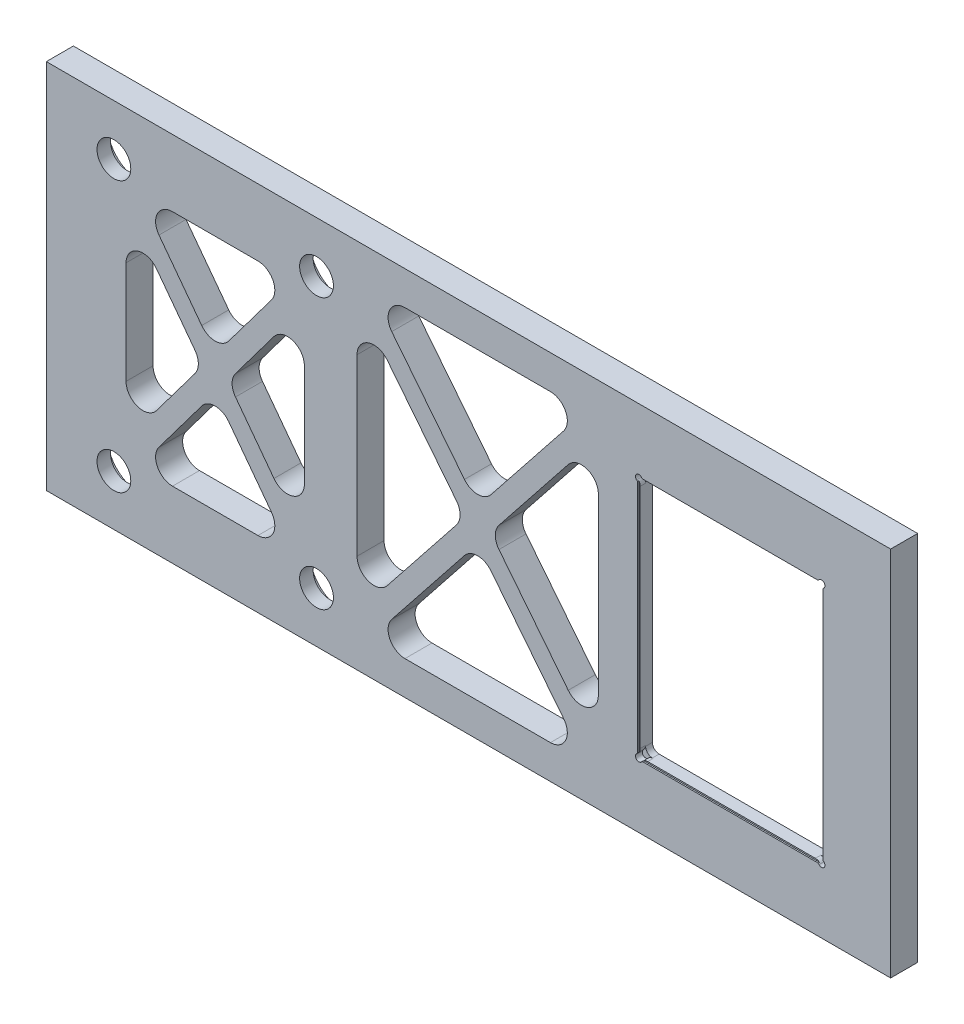
from build123d import *

# Parameters (mm, degrees)
SKETCH1_W           = 125
SKETCH1_H           = 55
SKETCH1_R           = 2.5
SKETCH1_W_2         = 27.05
SKETCH1_H_2         = 35.85
BOSS_EXTRUDE1_DEPTH = 4
SKETCH2_R           = 0.5
CUT_EXTRUDE1_DEPTH  = 1
FILLET1_R           = 1
FILLET2_R           = 1
SKETCH7_W           = 27.45
SKETCH7_H           = 36.25
CUT_EXTRUDE2_DEPTH  = 0.2
CUT_EXTRUDE3_DEPTH  = 2
CUT_EXTRUDE4_DEPTH  = 1
CUT_EXTRUDE5_DEPTH  = 137.623570441
CUT_EXTRUDE6_DEPTH  = 137.623570441
FILLET3_R           = 2.5
SKETCH12_R          = 5
CUT_EXTRUDE7_DEPTH  = 2


with BuildPart() as part:
    # Sketch1 → Boss-Extrude1 (new body)
    with BuildSketch(Plane.XY):
        with Locations((62.5, 27.5)):
            Rectangle(SKETCH1_W, SKETCH1_H)
        with Locations((10, 47.5)):
            Circle(SKETCH1_R, mode=Mode.SUBTRACT)
        with Locations((40, 47.5)):
            Circle(SKETCH1_R, mode=Mode.SUBTRACT)
        with Locations((10, 7.5)):
            Circle(SKETCH1_R, mode=Mode.SUBTRACT)
        with Locations((40, 7.5)):
            Circle(SKETCH1_R, mode=Mode.SUBTRACT)
        with Locations((101.25, 27.5)):
            Rectangle(SKETCH1_W_2, SKETCH1_H_2, mode=Mode.SUBTRACT)
    extrude(amount=BOSS_EXTRUDE1_DEPTH)

    # Sketch2 → Cut-Extrude1 (cut)
    with BuildSketch(Plane.XY.offset(4)):
        with Locations((87.725, 45.425)):
            Circle(SKETCH2_R)
        with Locations((114.775, 45.425)):
            Circle(SKETCH2_R)
        with Locations((87.725, 9.575)):
            Circle(SKETCH2_R)
        with Locations((114.775, 9.575)):
            Circle(SKETCH2_R)
    extrude(amount=-CUT_EXTRUDE1_DEPTH, mode=Mode.SUBTRACT)

    # Fillet1
    # the kernel refuses this fillet: 1 mm, written as the material it adds along each edge
    with BuildSketch(Plane(origin=(114.775, 9.575, 0), x_dir=(-1, 0, 0), z_dir=(0, 0, 1))) as fillet1_piece_1_section:
        with BuildLine():
            CenterArc((FILLET1_R, -FILLET1_R), FILLET1_R, 90, 90)
            Line((0, -FILLET1_R), (0, 0))
            Line((0, 0), (FILLET1_R, 0))
        make_face()
    fillet1_piece_1 = extrude(amount=5.5, mode=Mode.PRIVATE)
    fillet1_piece_1 = split(fillet1_piece_1, bisect_by=Plane(origin=(114.157064257, 9.617383677, 4), z_dir=(0, 0, -1)), keep=Keep.TOP, mode=Mode.PRIVATE)
    fillet1_piece_1 = fillet1_piece_1 - Plane(origin=(114.775, 9.575, 1.5), x_dir=(1, 0, 0), z_dir=(0, 0, 1)) * Cylinder(0.5, 16, mode=Mode.PRIVATE)
    add(fillet1_piece_1)
    with BuildSketch(Plane(origin=(114.775, 9.575, 0), x_dir=(-1, 0, 0), z_dir=(0, 0, 1)), Plane(origin=(87.725, 9.575, 0), x_dir=(0, 1, 0), z_dir=(0, 0, 1)), Plane(origin=(114.775, 45.425, 0), x_dir=(0, -1, 0), z_dir=(0, 0, 1))) as fillet1_piece_2:
        with BuildLine():
            CenterArc((FILLET1_R, -FILLET1_R), FILLET1_R, 90, 90)
            Line((0, -FILLET1_R), (0, 0))
            Line((0, 0), (FILLET1_R, 0))
        make_face()
    extrude(amount=3)
    with BuildSketch(Plane(origin=(87.725, 9.575, 0), x_dir=(0, 1, 0), z_dir=(0, 0, 1))) as fillet1_piece_3_section:
        with BuildLine():
            CenterArc((FILLET1_R, -FILLET1_R), FILLET1_R, 90, 90)
            Line((0, -FILLET1_R), (0, 0))
            Line((0, 0), (FILLET1_R, 0))
        make_face()
    fillet1_piece_3 = extrude(amount=5.5, mode=Mode.PRIVATE)
    fillet1_piece_3 = split(fillet1_piece_3, bisect_by=Plane(origin=(87.767383677, 10.192935743, 4), z_dir=(0, 0, -1)), keep=Keep.TOP, mode=Mode.PRIVATE)
    fillet1_piece_3 = fillet1_piece_3 - Plane(origin=(87.725, 9.575, 1.5), x_dir=(1, 0, 0), z_dir=(0, 0, 1)) * Cylinder(0.5, 15, mode=Mode.PRIVATE)
    add(fillet1_piece_3)
    with BuildSketch(Plane(origin=(114.775, 45.425, 0), x_dir=(0, -1, 0), z_dir=(0, 0, 1))) as fillet1_piece_4_section:
        with BuildLine():
            CenterArc((FILLET1_R, -FILLET1_R), FILLET1_R, 90, 90)
            Line((0, -FILLET1_R), (0, 0))
            Line((0, 0), (FILLET1_R, 0))
        make_face()
    fillet1_piece_4 = extrude(amount=5.5, mode=Mode.PRIVATE)
    fillet1_piece_4 = split(fillet1_piece_4, bisect_by=Plane(origin=(114.732616323, 44.807064257, 4), z_dir=(0, 0, -1)), keep=Keep.TOP, mode=Mode.PRIVATE)
    fillet1_piece_4 = fillet1_piece_4 - Plane(origin=(114.775, 45.425, 1.5), x_dir=(1, 0, 0), z_dir=(0, 0, 1)) * Cylinder(0.5, 15, mode=Mode.PRIVATE)
    add(fillet1_piece_4)
    with BuildSketch(Plane(origin=(87.725, 45.425, 0), x_dir=(0, -1, 0), z_dir=(0, 0, 1))) as fillet1_piece_5_section:
        with BuildLine():
            CenterArc((FILLET1_R, FILLET1_R), FILLET1_R, 180, 90)
            Line((0, FILLET1_R), (0, 0))
            Line((0, 0), (FILLET1_R, 0))
        make_face()
    fillet1_piece_5 = extrude(amount=5.5, mode=Mode.PRIVATE)
    fillet1_piece_5 = split(fillet1_piece_5, bisect_by=Plane(origin=(87.767383677, 44.807064257, 4), z_dir=(0, 0, -1)), keep=Keep.TOP, mode=Mode.PRIVATE)
    fillet1_piece_5 = fillet1_piece_5 - Plane(origin=(87.725, 45.425, 1.5), x_dir=(1, 0, 0), z_dir=(0, 0, 1)) * Cylinder(0.5, 16, mode=Mode.PRIVATE)
    add(fillet1_piece_5)
    with BuildSketch(Plane(origin=(87.725, 45.425, 0), x_dir=(0, -1, 0), z_dir=(0, 0, 1))) as fillet1_piece_6:
        with BuildLine():
            CenterArc((FILLET1_R, FILLET1_R), FILLET1_R, 180, 90)
            Line((0, FILLET1_R), (0, 0))
            Line((0, 0), (FILLET1_R, 0))
        make_face()
    extrude(amount=3)

    # Fillet2
    # the kernel refuses this fillet: 1 mm, written as the material it takes off along each edge
    with BuildSketch(Plane(origin=(114.297140543, 9.722140543, 5.642166577), x_dir=(-0.9745882982080014, -0.22400368076447263, 0), z_dir=(0, 0, -1)), Plane(origin=(87.872140543, 10.052859457, 5.642166577), x_dir=(-0.22400368076451274, 0.9745882982079922, 0), z_dir=(0, 0, -1)), Plane(origin=(114.627859457, 44.947140543, 5.642166577), x_dir=(0.22400368076446278, -0.9745882982080036, 0), z_dir=(0, 0, -1)), Plane(origin=(88.202859457, 45.277859457, 5.642166577), x_dir=(0.974588298207998, 0.22400368076448807, 0), z_dir=(0, 0, -1))) as fillet2_piece_1:
        with BuildLine():
            CenterArc((0.880870312, -0.974588298), FILLET2_R, 102.944297934, 48.189685104)
            Line((0.005119296, -0.491825252), (-0.082455806, -0.443548947))
            ThreePointArc((-0.082455806, -0.443548947), (-0.032777878, -0.246280446), (-0.086551242, -0.050088746))
            Line((-0.086551242, -0.050088746), (0.031782841, 0.094814825))
            ThreePointArc((0.031782841, 0.094814825), (0.519431718, 0.071018782), (0.634466263, 0.09745883))
            Line((0.634466263, 0.09745883), (0.656866631, 0))
        make_face()
    extrude(amount=2.642166577, mode=Mode.SUBTRACT)
    with BuildSketch(Plane(origin=(114.627859457, 10.052859457, 5.642166577), x_dir=(0.22400368076446103, 0.9745882982080041, 0), z_dir=(0, 0, -1)), Plane(origin=(88.202859457, 9.722140543, 5.642166577), x_dir=(0.9745882982080036, -0.22400368076446323, 0), z_dir=(0, 0, -1)), Plane(origin=(114.297140543, 45.277859457, 5.642166577), x_dir=(-0.974588298207998, 0.22400368076448807, 0), z_dir=(0, 0, -1)), Plane(origin=(87.872140543, 44.947140543, 5.642166577), x_dir=(-0.22400368076451097, -0.9745882982079925, 0), z_dir=(0, 0, -1))) as fillet2_piece_2:
        with BuildLine():
            CenterArc((0.880870312, 0.974588298), FILLET2_R, 208.866016962, 48.189685104)
            Line((0.005119296, 0.491825252), (-0.082455806, 0.443548947))
            ThreePointArc((-0.082455806, 0.443548947), (-0.032777878, 0.246280446), (-0.086551242, 0.050088746))
            Line((-0.086551242, 0.050088746), (0.031782841, -0.094814825))
            ThreePointArc((0.031782841, -0.094814825), (0.519431718, -0.071018782), (0.634466263, -0.09745883))
            Line((0.634466263, -0.09745883), (0.656866631, 0))
        make_face()
    extrude(amount=2.642166577, mode=Mode.SUBTRACT)

    # Sketch7 → Cut-Extrude2 (cut)
    with BuildSketch(Plane.XY.offset(4)):
        with Locations((101.25, 27.5)):
            Rectangle(SKETCH7_W, SKETCH7_H)
    extrude(amount=-CUT_EXTRUDE2_DEPTH, mode=Mode.SUBTRACT)

    # Sketch8 → Cut-Extrude3 (cut)
    with BuildSketch(Plane(origin=(0, 0, 0), x_dir=(-1, 0, 0), z_dir=(0, 0, -1))):
        with BuildLine():
            Line((-116.275, 44.425), (-116.275, 10.575))
            ThreePointArc((-116.275, 10.575), (-115.542766953, 8.807233047), (-113.775, 8.075))
            Line((-113.775, 8.075), (-88.725, 8.075))
            ThreePointArc((-88.725, 8.075), (-86.957233047, 8.807233047), (-86.225, 10.575))
            Line((-86.225, 10.575), (-86.225, 44.425))
            ThreePointArc((-86.225, 44.425), (-86.957233047, 46.192766953), (-88.725, 46.925))
            Line((-88.725, 46.925), (-113.775, 46.925))
            ThreePointArc((-113.775, 46.925), (-115.542766953, 46.192766953), (-116.275, 44.425))
        make_face()
    extrude(amount=-CUT_EXTRUDE3_DEPTH, mode=Mode.SUBTRACT)

    # Sketch9 → Cut-Extrude4 (cut)
    with BuildSketch(Plane(origin=(0, 0, 0), x_dir=(-1, 0, 0), z_dir=(0, 0, -1))):
        with BuildLine():
            Line((-117.775, 44.425), (-117.775, 10.575))
            ThreePointArc((-117.775, 10.575), (-116.603427125, 7.746572875), (-113.775, 6.575))
            Line((-113.775, 6.575), (-88.725, 6.575))
            ThreePointArc((-88.725, 6.575), (-85.896572875, 7.746572875), (-84.725, 10.575))
            Line((-84.725, 10.575), (-84.725, 44.425))
            ThreePointArc((-84.725, 44.425), (-85.896572875, 47.253427125), (-88.725, 48.425))
            Line((-88.725, 48.425), (-113.775, 48.425))
            ThreePointArc((-113.775, 48.425), (-116.603427125, 47.253427125), (-117.775, 44.425))
        make_face()
    extrude(amount=-CUT_EXTRUDE4_DEPTH, mode=Mode.SUBTRACT)

    # Sketch10 → Cut-Extrude5 (cut, through all)
    with BuildSketch(Plane(origin=(0, 0, 0), x_dir=(-1, 0, 0), z_dir=(0, 0, -1))):
        Polygon((-38.2, 42.6), (-26.875, 27.5), (-38.2, 12.4), align=None)
        Polygon((-36.325, 45.1), (-13.675, 45.1), (-25, 30), align=None)
        Polygon((-36.325, 9.9), (-25, 25), (-13.675, 9.9), align=None)
        Polygon((-11.8, 42.6), (-23.125, 27.5), (-11.8, 12.4), align=None)
    extrude(amount=-CUT_EXTRUDE5_DEPTH, mode=Mode.SUBTRACT)

    # Sketch11 → Cut-Extrude6 (cut, through all)
    with BuildSketch(Plane(origin=(0, 0, 0), x_dir=(-1, 0, 0), z_dir=(0, 0, -1))):
        Polygon((-81.725, 47.58754115), (-65.777724276, 27.5), (-81.725, 7.41245885), align=None)
        Polygon((-79.809775724, 50), (-47.915224276, 50), (-63.8625, 29.91245885), align=None)
        Polygon((-79.809775724, 5), (-63.8625, 25.08754115), (-47.915224276, 5), align=None)
        Polygon((-46, 47.58754115), (-61.947275724, 27.5), (-46, 7.41245885), align=None)
    extrude(amount=-CUT_EXTRUDE6_DEPTH, mode=Mode.SUBTRACT)

    # Fillet3
    fillet3_edges = [part.edges().sort_by_distance(p)[0] for p in [
        (25, 30, 2),
        (36.325, 45.1, 2),
        (13.675, 45.1, 2),
        (13.675, 9.9, 2),
        (36.325, 9.9, 2),
        (25, 25, 2),
        (11.8, 42.6, 2),
        (11.8, 12.4, 2),
        (23.125, 27.5, 2),
        (38.2, 12.4, 2),
        (38.2, 42.6, 2),
        (26.875, 27.5, 2),
        (63.8625, 29.91245885, 2),
        (79.809775724, 50, 2),
        (47.915224276, 50, 2),
        (47.915224276, 5, 2),
        (79.809775724, 5, 2),
        (63.8625, 25.08754115, 2),
        (46, 47.58754115, 2),
        (46, 7.41245885, 2),
        (61.947275724, 27.5, 2),
        (81.725, 7.41245885, 2),
        (81.725, 47.58754115, 2),
        (65.777724276, 27.5, 2),
    ]]
    fillet(fillet3_edges, radius=FILLET3_R)

    # Sketch12 → Cut-Extrude7 (cut)
    with BuildSketch(Plane(origin=(0, 0, 0), x_dir=(-1, 0, 0), z_dir=(0, 0, -1))):
        with Locations((-40, 47.5)):
            Circle(SKETCH12_R)
        with Locations((-10, 47.5)):
            Circle(SKETCH12_R)
        with Locations((-40, 7.5)):
            Circle(SKETCH12_R)
        with Locations((-10, 7.5)):
            Circle(SKETCH12_R)
    extrude(amount=-CUT_EXTRUDE7_DEPTH, mode=Mode.SUBTRACT)


solid = part.part
